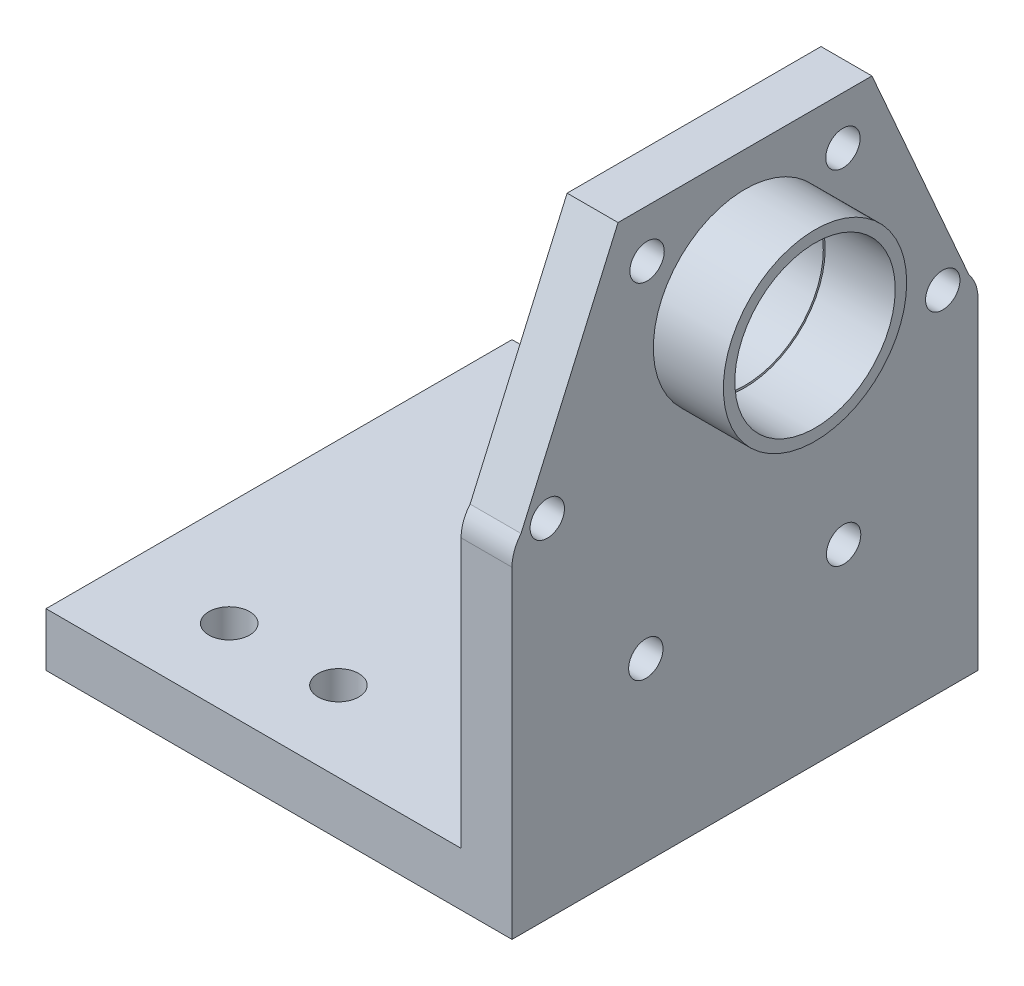
from build123d import *

# Parameters (mm, degrees)
EXTRUDE_1_DEPTH      = 40.6
EXTRUDE_1_DEPTH_BACK = 4
SKETCH_1_W           = 36.6
SKETCH_1_H           = 36.6
SKETCH_2_W           = 32.6
SKETCH_2_H           = 36.6
CUT_EXTRUDE_1_DEPTH  = 40.4
SKETCH_3_R           = 6.15
SKETCH_3_R_2         = 1.35
CUT_EXTRUDE_5_DEPTH  = 36.6
FILLET_2_R           = 2
SKETCH_7_R           = 1.6
CUT_EXTRUDE_6_DEPTH  = 10
CUT_EXTRUDE_8_DEPTH  = 10
FILLET_5_R           = 3
FILLET_6_R           = 3
SKETCH_17_R          = 7.2
EXTRUDE_2_DEPTH      = 5.5
SKETCH_18_R          = 6.3
CUT_EXTRUDE_9_DEPTH  = 5.5


with BuildPart() as part:
    # 草图1 → 凸台-拉伸1 (new, two sides: drawn at the far end of the back side and taken through both)
    with BuildSketch(Plane(origin=(0, 0, 0), x_dir=(1, 0, 0), z_dir=(0, 1, 0)).offset(-EXTRUDE_1_DEPTH_BACK)):
        Rectangle(SKETCH_1_W, SKETCH_1_H)
    extrude(amount=EXTRUDE_1_DEPTH + EXTRUDE_1_DEPTH_BACK)

    # 草图2 → 切除-拉伸1 (cut)
    with BuildSketch(Plane(origin=(0, 40.6, 0), x_dir=(1, 0, 0), z_dir=(0, 1, 0))):
        with Locations((-2, 0)):
            Rectangle(SKETCH_2_W, SKETCH_2_H)
    extrude(amount=-CUT_EXTRUDE_1_DEPTH, mode=Mode.SUBTRACT)

    # 草图3 → 切除-拉伸5 (cut)
    with BuildSketch(Plane(origin=(18.3, 0, 0), x_dir=(0, 0, -1), z_dir=(1, 0, 0))):
        with Locations((0, 30.682903148)):
            Circle(SKETCH_3_R)
        with Locations((-7.691951836, 36.832903148)):
            Circle(SKETCH_3_R_2)
        with Locations((7.691951836, 36.832903148)):
            Circle(SKETCH_3_R_2)
        with Locations((-15.529977583, 23.257044321)):
            Circle(SKETCH_3_R_2)
        with Locations((15.529977583, 23.257044321)):
            Circle(SKETCH_3_R_2)
        with Locations((7.745235234, 9.85104245)):
            Circle(SKETCH_3_R_2)
        with Locations((-7.790018794, 9.85104245)):
            Circle(SKETCH_3_R_2)
    extrude(amount=-CUT_EXTRUDE_5_DEPTH, mode=Mode.SUBTRACT)

    # 圆角2
    fillet_2_edges = [part.edges().sort_by_distance(p)[0] for p in [
        (16.3, 40.6, -18.3),
        (16.3, 40.6, 18.3),
    ]]
    fillet(fillet_2_edges, radius=FILLET_2_R)

    # 草图7 → 切除-拉伸6 (cut)
    with BuildSketch(Plane(origin=(0, -4, 0), x_dir=(-1, 0, 0), z_dir=(0, -1, 0))):
        with Locations(Location((1.606935512, 12.025, 0), (0, 0, 90))):
            Circle(SKETCH_7_R)
        with Locations(Location((10.106572894, 12.103513479, 0), (0, 0, 90))):
            Circle(SKETCH_7_R)
        with Locations(Location((10.106572894, -12.103513479, 0), (0, 0, 270))):
            Circle(SKETCH_7_R)
        with Locations(Location((1.606935512, -12.025, 0), (0, 0, 270))):
            Circle(SKETCH_7_R)
    extrude(amount=-CUT_EXTRUDE_6_DEPTH, mode=Mode.SUBTRACT)

    # 草图12 → 切除-拉伸8 (cut)
    with BuildSketch(Plane(origin=(18.3, 0, 0), x_dir=(0, 0, -1), z_dir=(1, 0, 0))):
        Polygon((-17.589988792, 23.257044321), (-11.626385684, 36.832903148), (-9.971575423, 40.6), (-18.3, 40.6), (-18.3, 23.257044321), align=None)
        Polygon((18.3, 23.257044321), (18.3, 40.6), (9.971575423, 40.6), (11.626385684, 36.832903148), (17.589988792, 23.257044321), align=None)
    extrude(amount=-CUT_EXTRUDE_8_DEPTH, mode=Mode.SUBTRACT)

    # 圆角5
    # the kernel refuses this fillet: 3 mm, written as the material it takes off along each edge
    with BuildSketch(Plane(origin=(23.145069229, 23.257044321, 18.3), x_dir=(0, -1, 0), z_dir=(-1, 0, 0))) as fillet_5_piece_1:
        with BuildLine():
            CenterArc((1.938027692, -3), FILLET_5_R, 90, 40.241386347)
            Line((0, -0.710011208), (-0.038760554, -0.664211432))
            ThreePointArc((-0.038760554, -0.664211432), (-0.06, -0.355005604), (-0.06, 0))
            Line((-0.06, 0), (0, 0.06))
            Line((0, 0.06), (1.938027692, 0.06))
            Line((1.938027692, 0.06), (1.938027692, 0))
        make_face()
    extrude(amount=13.690138458, mode=Mode.SUBTRACT)

    # 圆角6
    # the kernel refuses this fillet: 3 mm, written as the material it takes off along each edge
    with BuildSketch(Plane(origin=(23.145069229, 23.257044321, -18.3), x_dir=(0, -1, 0), z_dir=(-1, 0, 0))) as fillet_6_piece_1:
        with BuildLine():
            CenterArc((1.938027692, 3), FILLET_6_R, 229.758613653, 40.241386347)
            Line((0, 0.710011208), (-0.038760554, 0.664211432))
            ThreePointArc((-0.038760554, 0.664211432), (-0.06, 0.355005604), (-0.06, 0))
            Line((-0.06, 0), (0, -0.06))
            Line((0, -0.06), (1.938027692, -0.06))
            Line((1.938027692, -0.06), (1.938027692, 0))
        make_face()
    extrude(amount=13.690138458, mode=Mode.SUBTRACT)

    # 草图17 → 凸台-拉伸2 (add)
    with BuildSketch(Plane(origin=(18.3, 0, 0), x_dir=(0, 0, -1), z_dir=(1, 0, 0))):
        with Locations((0, 30.682903148)):
            Circle(SKETCH_17_R)
    extrude(amount=EXTRUDE_2_DEPTH)

    # 草图18 → 切除-拉伸9 (cut)
    with BuildSketch(Plane(origin=(23.8, 0, 0), x_dir=(0, 0, -1), z_dir=(1, 0, 0))):
        with Locations((0, 30.682903148)):
            Circle(SKETCH_18_R)
    extrude(amount=-CUT_EXTRUDE_9_DEPTH, mode=Mode.SUBTRACT)


solid = part.part
